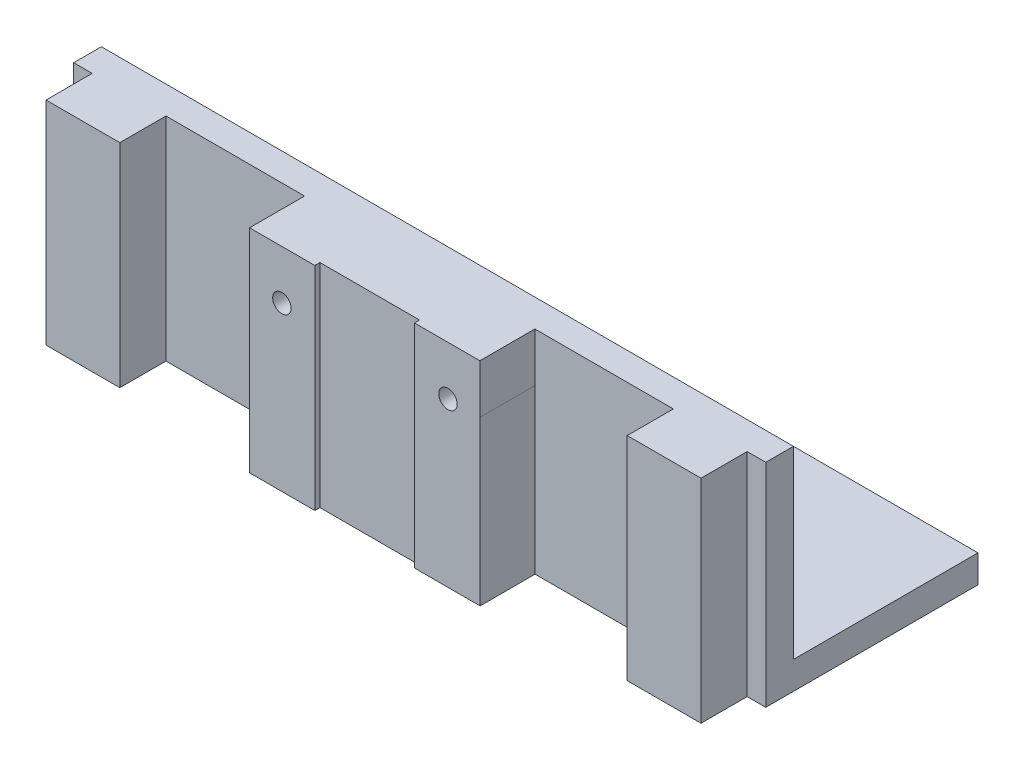
from build123d import *

# Parameters (mm, degrees)
SKETCH1_W            = 50
SKETCH1_H            = 23
BOSS_EXTRUDE12_DEPTH = 3
SKETCH17_W           = 50
SKETCH17_H           = 3
BOSS_EXTRUDE13_DEPTH = 20
BOSS_EXTRUDE15_DEPTH = 25
SKETCH19_R           = 3
CUT_EXTRUDE1_DEPTH   = 10
BOSS_EXTRUDE16_START = 2.5
SKETCH20_R           = 4
SKETCH20_R_2         = 3
BOSS_EXTRUDE16_DEPTH = 2.5
BOSS_EXTRUDE17_DEPTH = 5.96
CUT_EXTRUDE2_DEPTH   = 59.780112283
SKETCH23_R           = 1
CUT_EXTRUDE3_DEPTH   = 63.190687406
SKETCH24_W           = 8
SKETCH24_H           = 23
BOSS_EXTRUDE20_DEPTH = 5


with BuildPart() as part:
    # Sketch1 → Boss-Extrude12 (new body)
    with BuildSketch(Plane(origin=(0, 0, 0), x_dir=(1, 0, 0), z_dir=(0, 1, 0))):
        Rectangle(SKETCH1_W, SKETCH1_H)
    extrude(amount=BOSS_EXTRUDE12_DEPTH)

    # Sketch17 → Boss-Extrude13 (add)
    with BuildSketch(Plane(origin=(0, 3, 0), x_dir=(1, 0, 0), z_dir=(0, 1, 0))):
        with Locations((0, -10)):
            Rectangle(SKETCH17_W, SKETCH17_H)
    extrude(amount=BOSS_EXTRUDE13_DEPTH)

    # Sketch18 → Boss-Extrude15 (add)
    with BuildSketch(Plane(origin=(25, 0, 0), x_dir=(0, 0, -1), z_dir=(1, 0, 0))):
        Polygon((-11.5, 23), (-8.5, 23), (-8.5, 3), (11.5, 3), (11.5, 0), (-11.5, 0), align=None)
    extrude(amount=BOSS_EXTRUDE15_DEPTH)

    # Sketch19 → Cut-Extrude1 (cut)
    with BuildSketch(Plane.XZ):
        with Locations((-7.5, -1.069311776)):
            Circle(SKETCH19_R)
        with Locations((12.5, -1.069311776)):
            Circle(SKETCH19_R)
        with Locations((32.5, -1.069311776)):
            Circle(SKETCH19_R)
    extrude(amount=-CUT_EXTRUDE1_DEPTH, mode=Mode.SUBTRACT)

    # Sketch20 → Boss-Extrude16 (add)
    # profile 1 of 3: a face of its own
    with BuildSketch(Plane.XZ.offset(BOSS_EXTRUDE16_START)):
        with Locations((-7.5, -1.069311776)):
            Circle(SKETCH20_R)
        with Locations((-7.5, -1.069311776)):
            Circle(SKETCH20_R_2, mode=Mode.SUBTRACT)
    # profile 2 of 3: a face of its own
    with BuildSketch(Plane.XZ.offset(BOSS_EXTRUDE16_START)):
        with Locations((12.5, -1.069311776)):
            Circle(SKETCH20_R)
        with Locations((12.5, -1.069311776)):
            Circle(SKETCH20_R_2, mode=Mode.SUBTRACT)
    # profile 3 of 3: a face of its own
    with BuildSketch(Plane.XZ.offset(BOSS_EXTRUDE16_START)):
        with Locations((32.5, -1.069311776)):
            Circle(SKETCH20_R)
        with Locations((32.5, -1.069311776)):
            Circle(SKETCH20_R_2, mode=Mode.SUBTRACT)
    extrude(amount=-BOSS_EXTRUDE16_DEPTH)

    # Sketch21 → Boss-Extrude17 (add)
    with BuildSketch(Plane.XY.offset(11.5)):
        Polygon((0.022791851, 17.683942334), (0, 0), (25, 0), (24.977208149, 17.683942334), (24.977208149, 23), (0.022791851, 23), align=None)
    extrude(amount=BOSS_EXTRUDE17_DEPTH)

    # Sketch22 → Cut-Extrude2 (cut, through all)
    with BuildSketch(Plane(origin=(0, 23, 0), x_dir=(1, 0, 0), z_dir=(0, 1, 0))):
        Polygon((15.892859801, -16.90901318), (17.890847614, -16.90901318), (17.890847614, -17.46), (7.092859801, -17.46), (7.092859801, -16.90901318), (9.092859801, -16.90901318), align=None)
    extrude(amount=-CUT_EXTRUDE2_DEPTH, mode=Mode.SUBTRACT)

    # Sketch23 → Cut-Extrude3 (cut, through all)
    with BuildSketch(Plane.XY.offset(17.46)):
        with Locations((3.522791851, 17.683942334)):
            Circle(SKETCH23_R)
        with Locations((21.522791851, 17.683942334)):
            Circle(SKETCH23_R)
    extrude(amount=-CUT_EXTRUDE3_DEPTH, mode=Mode.SUBTRACT)

    # Sketch24 → Boss-Extrude20 (add)
    with BuildSketch(Plane.XY.offset(11.5)):
        with Locations((-19, 11.5)):
            Rectangle(SKETCH24_W, SKETCH24_H)
        with Locations((43.983707415, 11.5)):
            Rectangle(SKETCH24_W, SKETCH24_H)
    extrude(amount=BOSS_EXTRUDE20_DEPTH)


solid = part.part
